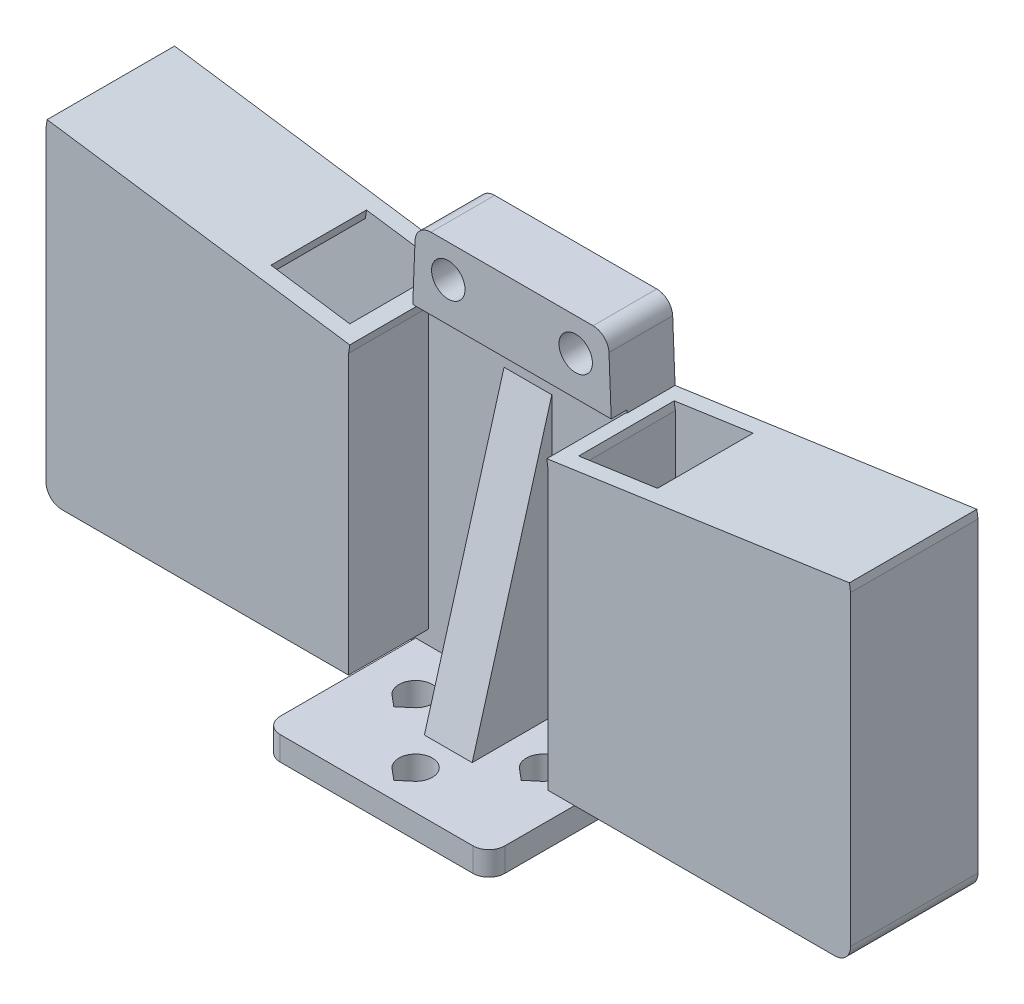
from build123d import *

# Parameters (mm, degrees)
SKETCH1_W           = 28.2
SKETCH1_H           = 19
BOSS_EXTRUDE1_DEPTH = 3
SKETCH2_R           = 2.1
BOSS_EXTRUDE2_DEPTH = 6
BOSS_EXTRUDE3_DEPTH = 3
FILLET1_R           = 2
SKETCH4_R           = 2.1
BOSS_EXTRUDE4_DEPTH = 2
BOSS_EXTRUDE5_DEPTH = 16
FILLET2_R           = 2
SHELL1_START        = -4
SHELL1_DEPTH        = 12
SKETCH6_W           = 38.395963329
SKETCH6_H           = 16
SKETCH6_W_2         = 34.354282979
SKETCH6_H_2         = 12
SKETCH6_W_3         = 24.354282979
BOSS_EXTRUDE6_DEPTH = 1
CHAMFER1_SIZE       = 2.887134603
CHAMFER1_SIZE_2     = 3


with BuildPart() as part:
    # Sketch1 → Boss-Extrude1 (new body)
    with BuildSketch(Plane(origin=(0, 0, 0), x_dir=(1, 0, 0), z_dir=(0, 1, 0))):
        with Locations((0, -9.5)):
            Rectangle(SKETCH1_W, SKETCH1_H)
        with BuildLine():
            Line((-9.34985398, -7.708693331), (-8, -8.841355308))
            Line((-8, -8.841355308), (-6.65014602, -7.708693331))
            ThreePointArc((-6.65014602, -7.708693331), (-8, -4), (-9.34985398, -7.708693331))
        make_face(mode=Mode.SUBTRACT)
        with BuildLine():
            Line((-1.34985398, -15.708693331), (0, -16.841355308))
            Line((0, -16.841355308), (1.34985398, -15.708693331))
            ThreePointArc((1.34985398, -15.708693331), (0, -12), (-1.34985398, -15.708693331))
        make_face(mode=Mode.SUBTRACT)
        with BuildLine():
            Line((6.65014602, -7.708693331), (8, -8.841355308))
            Line((8, -8.841355308), (9.34985398, -7.708693331))
            ThreePointArc((9.34985398, -7.708693331), (8, -4), (6.65014602, -7.708693331))
        make_face(mode=Mode.SUBTRACT)
    extrude(amount=BOSS_EXTRUDE1_DEPTH)

    # Sketch2 → Boss-Extrude2 (add)
    with BuildSketch(Plane(origin=(0, 0, 0), x_dir=(-1, 0, 0), z_dir=(0, 0, -1))):
        Polygon((-14.1, 0), (14.1, 0), (12.1, 50.1), (-12.1, 50.1), align=None)
        with Locations((-8, 46)):
            Circle(SKETCH2_R, mode=Mode.SUBTRACT)
        with Locations((8, 46)):
            Circle(SKETCH2_R, mode=Mode.SUBTRACT)
    extrude(amount=BOSS_EXTRUDE2_DEPTH)

    # Sketch3 → Boss-Extrude3 (add, symmetric)
    with BuildSketch(Plane(origin=(0, 0, 0), x_dir=(0, 0, -1), z_dir=(1, 0, 0))):
        Polygon((0, 3), (-10, 3), (0, 38), align=None)
    extrude(amount=BOSS_EXTRUDE3_DEPTH, both=True)

    # Fillet1
    fillet1_edges = [part.edges().sort_by_distance(p)[0] for p in [
        (12.1, 50.1, -3),
        (-12.1, 50.1, -3),
        (14.1, 1.5, 19),
        (-14.1, 1.5, 19),
    ]]
    fillet(fillet1_edges, radius=FILLET1_R)

    # Sketch4 → Boss-Extrude4 (add)
    with BuildSketch(Plane.XY):
        with BuildLine():
            Line((-10.178247335, 50.1), (10.178247335, 50.1))
            ThreePointArc((10.178247335, 50.1), (11.563968527, 49.54214312), (12.176655618, 48.179776778))
            Line((12.176655618, 48.179776778), (12.459281437, 41.1))
            Line((12.459281437, 41.1), (-12.459281437, 41.1))
            Line((-12.459281437, 41.1), (-12.176655618, 48.179776778))
            ThreePointArc((-12.176655618, 48.179776778), (-11.563968527, 49.54214312), (-10.178247335, 50.1))
        make_face()
        with Locations(Location((-8, 46, 0), (0, 0, 180))):
            Circle(SKETCH4_R, mode=Mode.SUBTRACT)
        with Locations(Location((8, 46, 0), (0, 0, 180))):
            Circle(SKETCH4_R, mode=Mode.SUBTRACT)
    extrude(amount=BOSS_EXTRUDE4_DEPTH)


with BuildPart() as body_2:
    # Sketch5 → Boss-Extrude5 (new body)
    with BuildSketch(Plane(origin=(0, 0, -6), x_dir=(-1, 0, 0), z_dir=(0, 0, -1))):
        Polygon((12.513173653, 39.75), (50.513173653, 45.25), (50.513173653, 4.75), (12.513173653, 4.75), align=None)
    extrude(amount=-BOSS_EXTRUDE5_DEPTH)

    # Fillet2
    fillet2_edges = [body_2.edges().sort_by_distance(p)[0] for p in [
        (-50.513173653, 4.75, 2),
    ]]
    fillet(fillet2_edges, radius=FILLET2_R)

    # Shell1: read off the stored shape, not the designer's step
    # Shell1 outline → Shell1 (cut)
    with BuildSketch(Plane.XY.offset(SHELL1_START)):
        Polygon((-48.513173653, 44.960526316), (-48.513173653, 6.75), (-14.513173653, 6.75), (-14.513173653, 40.039473684), align=None)
    extrude(amount=SHELL1_DEPTH, mode=Mode.SUBTRACT)

    # Sketch6 → Boss-Extrude6 (add)
    # profile 1 of 2: a face of its own
    with BuildSketch(Plane(origin=(5.378481599, 37.160418319, 0), x_dir=(0.9896873708806833, -0.14324422473273113, 0), z_dir=(0.14324422473273113, 0.9896873708806833, 0))):
        with Locations((-37.276069531, -2)):
            Rectangle(SKETCH6_W, SKETCH6_H)
        with Locations((-37.276069531, -2)):
            Rectangle(SKETCH6_W_2, SKETCH6_H_2, mode=Mode.SUBTRACT)
    # profile 2 of 2: a face of its own
    with BuildSketch(Plane(origin=(5.378481599, 37.160418319, 0), x_dir=(0.9896873708806833, -0.14324422473273113, 0), z_dir=(0.14324422473273113, 0.9896873708806833, 0))):
        with Locations((-42.276069531, -2)):
            Rectangle(SKETCH6_W_3, SKETCH6_H_2)
    extrude(amount=BOSS_EXTRUDE6_DEPTH)


with BuildPart() as body_3:
    # Mirror2: mirrored copy
    add(body_2.part.mirror(Plane(origin=(0, 0, 0), x_dir=(0, 0, 1), z_dir=(1, 0, 0))))


with BuildPart() as part_1:
    add(part.part)

    # Combine1: read off the stored shape, not the designer's step
    # Combine1: union body 3, body 2
    add(body_3.part)
    add(body_2.part)

    # Chamfer1
    # the kernel refuses this chamfer: 3, 2.887134603 mm, written as the material it adds along each edge
    with BuildSketch(Plane(origin=(-13.910379242, 4.75, -6), x_dir=(-0.039888388883066415, -0.9992041415207972, 0), z_dir=(0, 0, 1))) as chamfer1_piece_1:
        Polygon((CHAMFER1_SIZE, 0), (CHAMFER1_SIZE_2 * 0.0398883888831, -CHAMFER1_SIZE_2 * 0.999204141521), (0, 0), align=None)
    extrude(amount=6)
    with BuildSketch(Plane(origin=(13.910379242, 4.75, -6), x_dir=(0.039888388883066304, -0.9992041415207972, 0), z_dir=(0, 0, 1))) as chamfer1_piece_2:
        Polygon((CHAMFER1_SIZE, 0), (CHAMFER1_SIZE_2 * 0.0398883888831, CHAMFER1_SIZE_2 * 0.999204141521), (0, 0), align=None)
    extrude(amount=6)


solid = part_1.part
